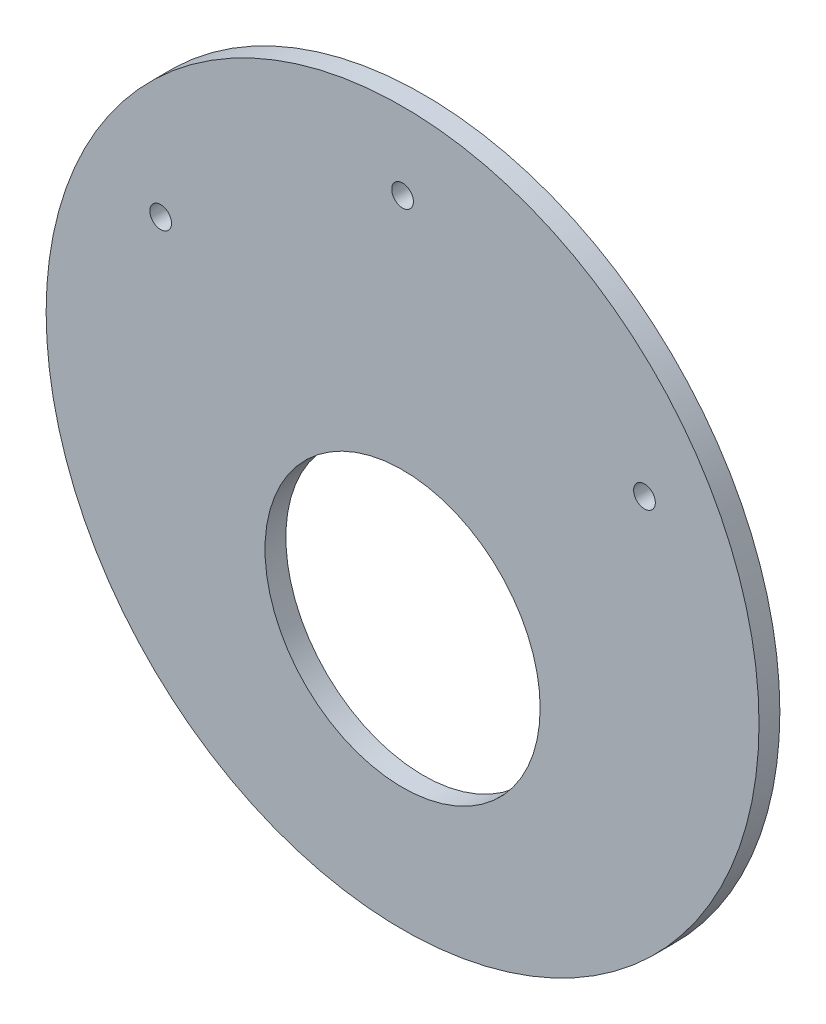
from build123d import *

# Parameters (mm, degrees)
SKETCH2_R                   = 85.5
BOSS_EXTRUDE1_DEPTH         = 5
SKETCH3_R                   = 33
CUT_EXTRUDE1_DEPTH          = 122.018593613
SKETCH4_R                   = 2.6
CUT_EXTRUDE2_DEPTH          = 122.018593613
CIRPATTERN3_COUNT           = 2
CIRPATTERN3_ANGLE           = 60
CIRPATTERN4_COPY_1_SKETCH_R = 2.6
CIRPATTERN4_COPY_1_DEPTH    = 122.018593613
CIRPATTERN4_COPY_2_SKETCH_R = 2.6
CIRPATTERN4_COPY_2_DEPTH    = 122.018593613


with BuildPart() as part:
    # Sketch2 → Boss-Extrude1 (new body)
    with BuildSketch(Plane.XY):
        Circle(SKETCH2_R)
    extrude(amount=BOSS_EXTRUDE1_DEPTH)

    # Sketch3 → Cut-Extrude1 (cut, through all)
    with BuildSketch(Plane.XY.offset(5)):
        with Locations((0, -23)):
            Circle(SKETCH3_R)
    extrude(amount=-CUT_EXTRUDE1_DEPTH, mode=Mode.SUBTRACT)

    # Sketch4 → Cut-Extrude2 (cut, through all)
    with BuildSketch(Plane.XY.offset(5)):
        with Locations((0, 67)):
            Circle(SKETCH4_R)
    cut_extrude2 = extrude(amount=-CUT_EXTRUDE2_DEPTH, mode=Mode.SUBTRACT)

    # CirPattern3: Cut-Extrude2 ×2 about axis
    cirpattern3_axis = Axis((0, 0, 5), (0, 0, 1))
    for i in range(1, CIRPATTERN3_COUNT):
        add(cut_extrude2.rotate(cirpattern3_axis, i * CIRPATTERN3_ANGLE / (CIRPATTERN3_COUNT - 1)), mode=Mode.SUBTRACT)

    # CirPattern4 copy 1 sketch → CirPattern4 copy 1 (cut, through all)
    with BuildSketch(Plane.XY.offset(5)):
        with Locations((0, 67)):
            Circle(CIRPATTERN4_COPY_1_SKETCH_R)
    extrude(amount=-CIRPATTERN4_COPY_1_DEPTH, mode=Mode.SUBTRACT)

    # CirPattern4 copy 2 sketch → CirPattern4 copy 2 (cut, through all)
    with BuildSketch(Plane(origin=(0, 0, 5), x_dir=(0.4999999999999978, -0.8660254037844399, 0), z_dir=(0, 0, 1))):
        with Locations((0, 67)):
            Circle(CIRPATTERN4_COPY_2_SKETCH_R)
    extrude(amount=-CIRPATTERN4_COPY_2_DEPTH, mode=Mode.SUBTRACT)


solid = part.part
